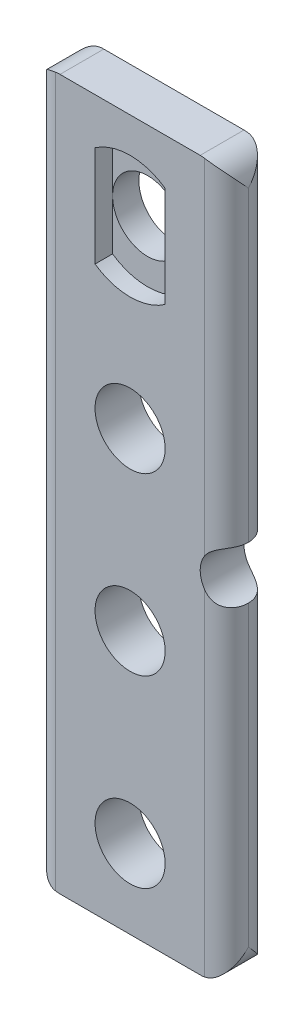
from build123d import *

# Parameters (mm, degrees)
ESQUISSE1_R             = 4
EXTRUSION1_DEPTH        = 5
ENL_V_MAT_EXTRU_1_DEPTH = 2
CONG_1_R                = 2.5


with BuildPart() as part:
    # Esquisse1 → Extrusion1 (new body)
    with BuildSketch(Plane.XY):
        with BuildLine():
            Line((-8, 0), (8, 0))
            ThreePointArc((8, 0), (10.121320344, 0.878679656), (11, 3))
            Line((11, 3), (11, 37))
            ThreePointArc((11, 37), (8, 40), (11, 43))
            Line((11, 43), (11, 78))
            ThreePointArc((11, 78), (10.121320344, 80.121320344), (8, 81))
            Line((8, 81), (-8, 81))
            ThreePointArc((-8, 81), (-10.121320344, 80.121320344), (-11, 78))
            Line((-11, 78), (-11, 3))
            ThreePointArc((-11, 3), (-10.121320344, 0.878679656), (-8, 0))
        make_face()
        with Locations((0, 9)):
            Circle(ESQUISSE1_R, mode=Mode.SUBTRACT)
        with Locations((0, 30)):
            Circle(ESQUISSE1_R, mode=Mode.SUBTRACT)
        with Locations((0, 50)):
            Circle(ESQUISSE1_R, mode=Mode.SUBTRACT)
        with Locations((0, 70)):
            Circle(ESQUISSE1_R, mode=Mode.SUBTRACT)
    extrude(amount=EXTRUSION1_DEPTH)

    # Esquisse2 → Enlèv. mat.-Extru.1 (cut)
    with BuildSketch(Plane.XY.offset(5)):
        with BuildLine():
            Line((4, 75.744562647), (4, 64.255437353))
            ThreePointArc((4, 64.255437353), (0, 63), (-4, 64.255437353))
            Line((-4, 64.255437353), (-4, 75.744562647))
            ThreePointArc((-4, 75.744562647), (0, 77), (4, 75.744562647))
        make_face()
    extrude(amount=-ENL_V_MAT_EXTRU_1_DEPTH, mode=Mode.SUBTRACT)

    # Congé1
    # the kernel refuses this fillet: 2.5 mm, written as the material it takes off along each edge
    with BuildSketch(Plane(origin=(11, -3.25, 0), x_dir=(0, 0, 1), z_dir=(0, 1, 0)), Plane(origin=(11, -3.25, 5), x_dir=(-1, 0, 0), z_dir=(0, 1, 0))) as cong_1_piece_1:
        with BuildLine():
            CenterArc((CONG_1_R, -CONG_1_R), CONG_1_R, 90, 90)
            Line((0, -CONG_1_R), (0, 0))
            Line((0, 0), (CONG_1_R, 0))
        make_face()
    extrude(amount=46.5, mode=Mode.SUBTRACT)
    with BuildSketch(Plane(origin=(-11, 84.25, 0), x_dir=(0, 0, 1), z_dir=(0, -1, 0))) as cong_1_piece_2:
        with BuildLine():
            CenterArc((CONG_1_R, -CONG_1_R), CONG_1_R, 90, 90)
            Line((0, -CONG_1_R), (0, 0))
            Line((0, 0), (CONG_1_R, 0))
        make_face()
    extrude(amount=87.5, mode=Mode.SUBTRACT)
    with BuildSketch(Plane(origin=(-11, 84.25, 5), x_dir=(0, 0, -1), z_dir=(0, -1, 0))) as cong_1_piece_3:
        with BuildLine():
            CenterArc((CONG_1_R, CONG_1_R), CONG_1_R, 180, 90)
            Line((0, CONG_1_R), (0, 0))
            Line((0, 0), (CONG_1_R, 0))
        make_face()
    extrude(amount=87.5, mode=Mode.SUBTRACT)
    with BuildSketch(Plane(origin=(11, 36.75, 0), x_dir=(0, 0, 1), z_dir=(0, 1, 0)), Plane(origin=(11, 36.75, 5), x_dir=(-1, 0, 0), z_dir=(0, 1, 0))) as cong_1_piece_4:
        with BuildLine():
            CenterArc((CONG_1_R, -CONG_1_R), CONG_1_R, 90, 90)
            Line((0, -CONG_1_R), (0, 0))
            Line((0, 0), (CONG_1_R, 0))
        make_face()
    extrude(amount=47.5, mode=Mode.SUBTRACT)


solid = part.part
